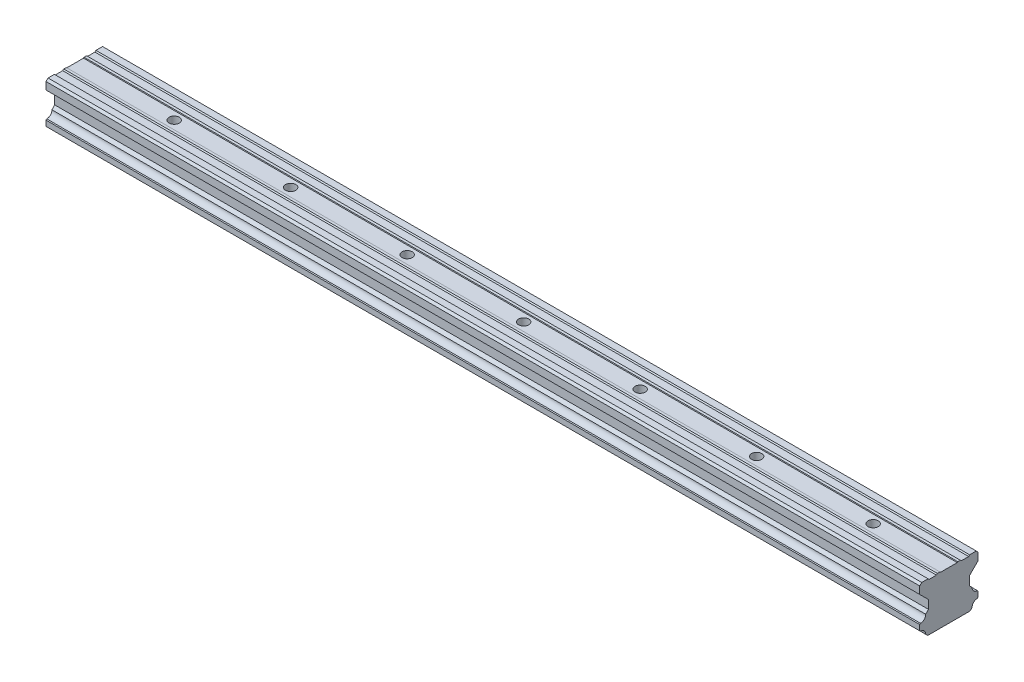
from build123d import *

# Parameters (mm, degrees)
BOSS_EXTRUDE1_DEPTH = 300
HOLE1_D             = 3.5
HOLE1_CBORE_D       = 6
HOLE1_CBORE_DEPTH   = 4.5
LPATTERN1_COUNT     = 7
LPATTERN1_PITCH     = 40


with BuildPart() as part:
    # Sketch1 → Boss-Extrude1 (new body)
    with BuildSketch(Plane(origin=(0, 0, 0), x_dir=(0, 0, -1), z_dir=(1, 0, 0))):
        with BuildLine():
            Line((-7.965754986, -7.693975449), (-7.266272068, -8.393458366))
            Line((-7.266272068, -8.393458366), (7.266272068, -8.393458366))
            Line((7.266272068, -8.393458366), (7.965754986, -7.693975449))
            ThreePointArc((7.965754986, -7.693975449), (8.474723757, -6.421557866), (9.747437917, -5.913331162))
            Line((9.747437917, -5.913331162), (10.000000437, -5.660768637))
            Line((10.000000437, -5.660768637), (10.000000437, -3.788406023))
            Line((10.000000437, -3.788406023), (9.747437912, -3.535843503))
            ThreePointArc((9.747437912, -3.535843503), (8.462742055, -3.016656911), (7.965755402, -1.72321096))
            Line((7.965755402, -1.72321096), (7.005148341, -0.762603918))
            Line((7.005148341, -0.762603918), (7.005148341, 2.166206023))
            Line((7.005148341, 2.166206023), (10.000000347, 5.161058089))
            Line((10.000000347, 5.161058089), (10.000000347, 7.712387211))
            Line((10.000000347, 7.712387211), (9.408464779, 8.393458268))
            Line((9.408464779, 8.393458268), (7.133016457, 8.393458268))
            Line((7.133016457, 8.393458268), (6.789534443, 8.049976247))
            Line((6.789534443, 8.049976247), (4.271139656, 8.049976247))
            Line((4.271139656, 8.049976247), (3.927707784, 8.393458265))
            Line((3.927707784, 8.393458265), (3.061282509, 8.393458265))
            Line((3.061282509, 8.393458265), (2.872049327, 8.204225079))
            Line((2.872049327, 8.204225079), (-2.87204886, 8.204225079))
            Line((-2.87204886, 8.204225079), (-3.061282046, 8.393458261))
            Line((-3.061282046, 8.393458261), (-3.927707321, 8.393458261))
            Line((-3.927707321, 8.393458261), (-4.271189216, 8.049976359))
            Line((-4.271189216, 8.049976359), (-6.789534095, 8.049976359))
            Line((-6.789534095, 8.049976359), (-7.133016116, 8.393458373))
            Line((-7.133016116, 8.393458373), (-9.30771733, 8.393458373))
            Line((-9.30771733, 8.393458373), (-10, 7.70117569))
            Line((-10, 7.70117569), (-10, 5.161058187))
            Line((-10, 5.161058187), (-7.005147934, 2.166206181))
            Line((-7.005147934, 2.166206181), (-7.005147934, -0.76260376))
            Line((-7.005147934, -0.76260376), (-7.965754986, -1.723210812))
            ThreePointArc((-7.965754986, -1.723210812), (-8.462741848, -3.016656549), (-9.747437477, -3.535843372))
            Line((-9.747437477, -3.535843372), (-10, -3.788405895))
            Line((-10, -3.788405895), (-10, -5.660768509))
            Line((-10, -5.660768509), (-9.747437477, -5.913331032))
            ThreePointArc((-9.747437477, -5.913331032), (-8.474723558, -6.421557943), (-7.965754986, -7.693975449))
        make_face()
    extrude(amount=BOSS_EXTRUDE1_DEPTH)

    # Hole1 (through all)
    with Locations(Plane(origin=(34, -8.393458366, 0), x_dir=(0, 0, -1), z_dir=(0, -1, 0))):
        with Locations((0, 0)):
            hole1 = CounterBoreHole(HOLE1_D / 2, HOLE1_CBORE_D / 2, HOLE1_CBORE_DEPTH)

    # LPattern1: Hole1 ×7
    with Locations(*[(i * LPATTERN1_PITCH, 0, 0) for i in range(1, LPATTERN1_COUNT)]):
        add(hole1, mode=Mode.SUBTRACT)


solid = part.part
